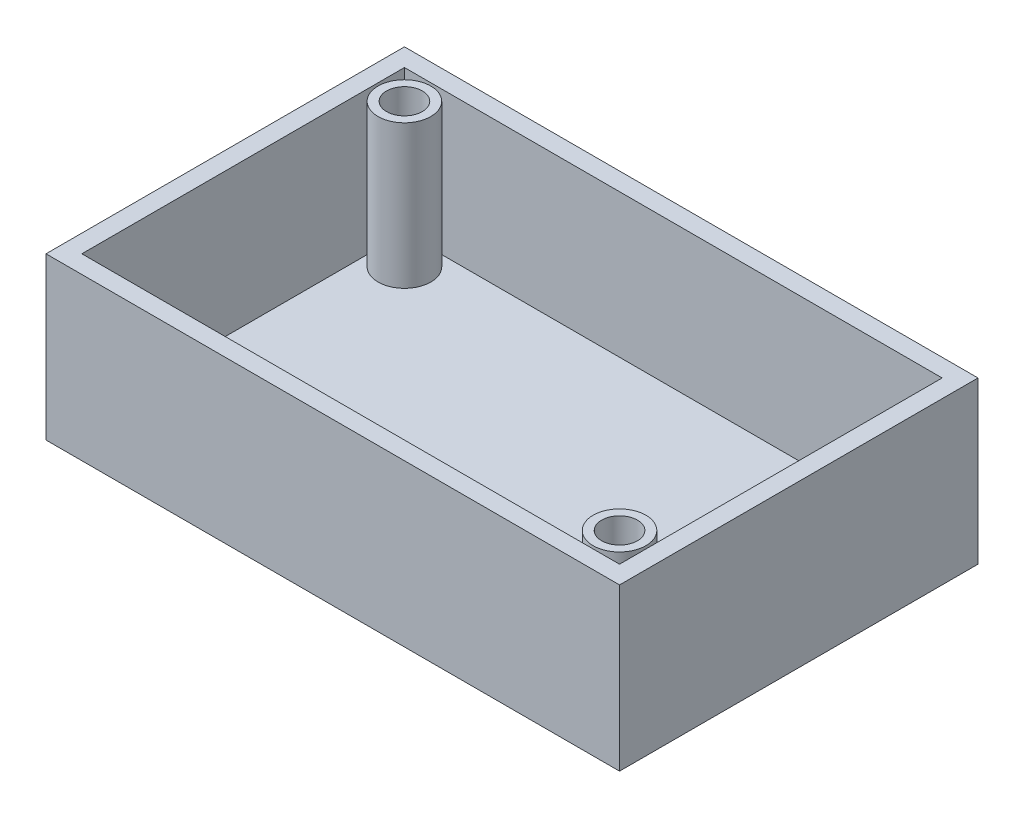
from build123d import *

# Parameters (mm, degrees)
SKETCH1_W           = 101.6
SKETCH1_H           = 63.5
BOSS_EXTRUDE1_DEPTH = 3.175
SKETCH2_W           = 101.6
SKETCH2_H           = 63.5
SKETCH2_W_2         = 95.25
SKETCH2_H_2         = 57.15
BOSS_EXTRUDE3_DEPTH = 25.4
SKETCH3_R           = 2.141141326
CUT_EXTRUDE1_DEPTH  = 3.175
SKETCH5_R           = 4.675
SKETCH5_R_2         = 3.175
BOSS_EXTRUDE4_DEPTH = 25.4


with BuildPart() as part:
    # Sketch1 → Boss-Extrude1 (new body)
    with BuildSketch(Plane(origin=(0, 0, 0), x_dir=(1, 0, 0), z_dir=(0, 1, 0))):
        with Locations((11.723076923, 23.795054945)):
            Rectangle(SKETCH1_W, SKETCH1_H)
    extrude(amount=BOSS_EXTRUDE1_DEPTH)

    # Sketch2 → Boss-Extrude3 (add)
    with BuildSketch(Plane(origin=(0, 3.175, 0), x_dir=(1, 0, 0), z_dir=(0, 1, 0))):
        with Locations((11.723076923, 23.795054945)):
            Rectangle(SKETCH2_W, SKETCH2_H)
        with Locations((11.723076923, 23.795054945)):
            Rectangle(SKETCH2_W_2, SKETCH2_H_2, mode=Mode.SUBTRACT)
    extrude(amount=BOSS_EXTRUDE3_DEPTH)

    # Sketch3 → Cut-Extrude1 (cut)
    with BuildSketch(Plane.XZ):
        with Locations((47.814406836, -23.777289581)):
            Circle(SKETCH3_R)
    extrude(amount=-CUT_EXTRUDE1_DEPTH, mode=Mode.SUBTRACT)

    # Sketch5 → Boss-Extrude4 (add)
    # profile 1 of 2: a face of its own
    with BuildSketch(Plane(origin=(0, 3.175, 0), x_dir=(1, 0, 0), z_dir=(0, 1, 0))):
        with Locations((-30.726923077, 47.190054945)):
            Circle(SKETCH5_R)
        with Locations((-30.726923077, 47.190054945)):
            Circle(SKETCH5_R_2, mode=Mode.SUBTRACT)
    # profile 2 of 2: a face of its own
    with BuildSketch(Plane(origin=(0, 3.175, 0), x_dir=(1, 0, 0), z_dir=(0, 1, 0))):
        with Locations((54.168076923, 0.400054945)):
            Circle(SKETCH5_R)
        with Locations((54.168076923, 0.400054945)):
            Circle(SKETCH5_R_2, mode=Mode.SUBTRACT)
    extrude(amount=BOSS_EXTRUDE4_DEPTH)


solid = part.part
